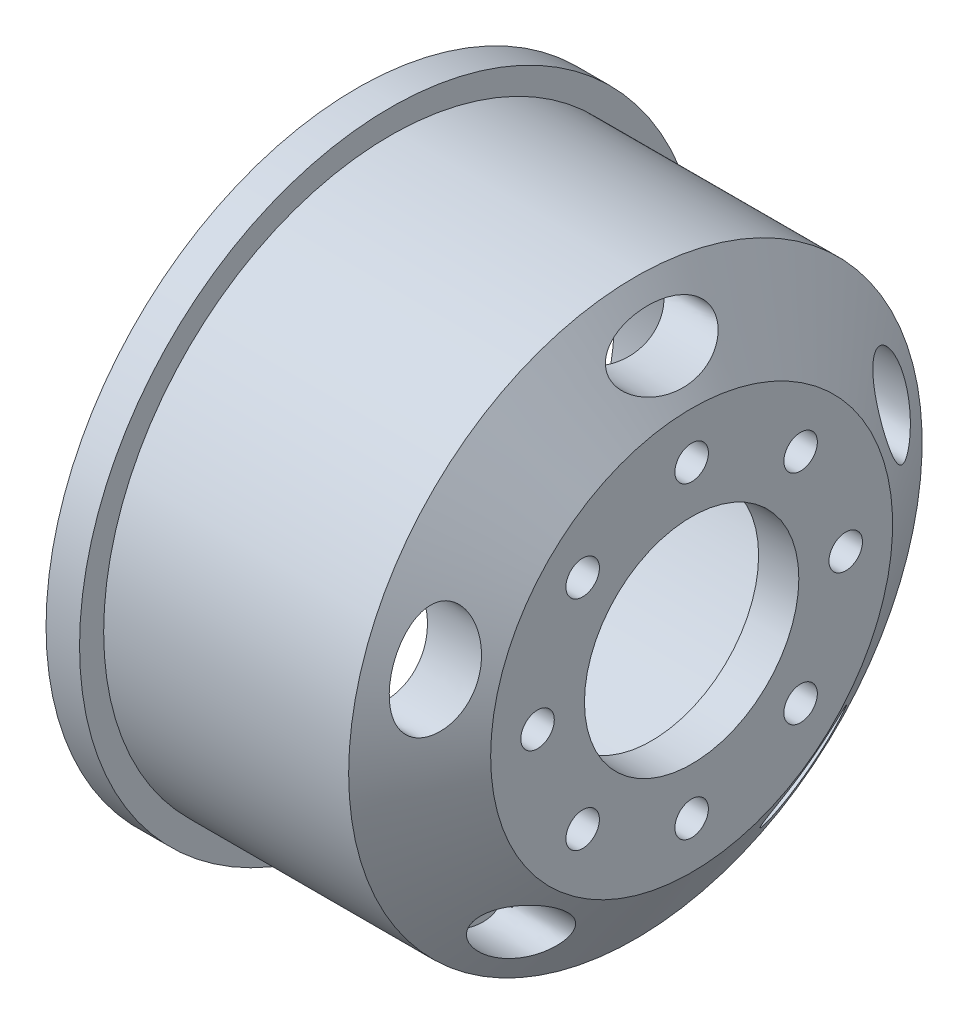
from build123d import *

# Parameters (mm, degrees)
CUT_EXTRUDE1_START     = -7
CUT_EXTRUDE1_OUTLINE_R = 1.25
CUT_EXTRUDE1_DEPTH     = 7


with BuildPart() as part:
    # Sketch3 → Revolve1 (revolve)
    with BuildSketch(Plane(origin=(0, 0, 0), x_dir=(1, 0, 0), z_dir=(0, 1, 0)), mode=Mode.PRIVATE) as revolve1_sk:
        Polygon((8.717608539, 21.4), (-7.11067022, 21.4), (-7.11067022, 23.2), (-8.61067022, 23.2), (-9.61067022, 23.2), (-9.61067022, 22.2), (-8.61067022, 22.2), (-8.61067022, 18.231946605), (9.211549898, 18.231946605), (12.36932978, 13.417613419), (12.36932978, 8), (15.36932978, 8), (15.36932978, 15), (11.171491687, 21.4), align=None)
    revolve(revolve1_sk.sketch.rotate(Axis((-29.774212385, 0, 0), (1, 0, 0)), 180), axis=Axis((-29.774212385, 0, 0), (1, 0, 0)))

    # Cut-Extrude1: read off the stored shape, not the designer's step
    # Cut-Extrude1 outline → Cut-Extrude1 (cut)
    with BuildSketch(Plane(origin=(15.36932978, 0, 0), x_dir=(0, 0, -1), z_dir=(1, 0, 0)).offset(CUT_EXTRUDE1_START)):
        with BuildLine():
            add(Edge.make_bspline(
                [(-15.882949316, 9.366531964), (-19.17750573, 10.436998233), (-19.384329489, 4.195426001), (-19.591153248, -2.046146232), (-16.089773075, 3.124959731), (-12.588392902, 8.296065695), (-15.882949316, 9.366531964)],
                knots=[0, 0, 0, 2.094395102, 2.094395102, 4.188790205, 4.188790205, 6.283185307, 6.283185307, 6.283185307], degree=2, weights=[1, 0.5, 1, 0.5, 1, 0.5, 1]))
        make_face()
        with BuildLine():
            add(Edge.make_bspline(
                [(-13.816202519, -12.21116489), (-15.852350361, -15.013681966), (-9.980174473, -17.139134942), (-4.107998586, -19.264587917), (-7.944026632, -14.336617865), (-11.780054677, -9.408647813), (-13.816202519, -12.21116489)],
                knots=[0, 0, 0, 2.094395102, 2.094395102, 4.188790205, 4.188790205, 6.283185307, 6.283185307, 6.283185307], degree=2, weights=[1, 0.5, 1, 0.5, 1, 0.5, 1]))
        make_face()
        with BuildLine():
            add(Edge.make_bspline(
                [(7.344066564, -16.913446908), (9.380214406, -19.715963985), (13.216242451, -14.787993933), (17.052270496, -9.86002388), (11.180094609, -11.985476856), (5.307918722, -14.110929831), (7.344066564, -16.913446908)],
                knots=[0, 0, 0, 2.094395102, 2.094395102, 4.188790205, 4.188790205, 6.283185307, 6.283185307, 6.283185307], degree=2, weights=[1, 0.5, 1, 0.5, 1, 0.5, 1]))
        make_face()
        with BuildLine():
            add(Edge.make_bspline(
                [(18.355085271, 1.758079834), (21.649641685, 2.828546103), (18.148261512, 7.999652066), (14.646881338, 13.170758029), (14.853705097, 6.929185797), (15.060528857, 0.687613564), (18.355085271, 1.758079834)],
                knots=[0, 0, 0, 2.094395102, 2.094395102, 4.188790205, 4.188790205, 6.283185307, 6.283185307, 6.283185307], degree=2, weights=[1, 0.5, 1, 0.5, 1, 0.5, 1]))
        make_face()
        with BuildLine():
            add(Edge.make_bspline(
                [(4, 18), (4, 21.464101615), (-2, 19.732050808), (-8, 18), (-2, 16.267949192), (4, 14.535898385), (4, 18)],
                knots=[0, 0, 0, 2.094395102, 2.094395102, 4.188790205, 4.188790205, 6.283185307, 6.283185307, 6.283185307], degree=2, weights=[1, 0.5, 1, 0.5, 1, 0.5, 1]))
        make_face()
        with Locations((0, 11.5)):
            Circle(CUT_EXTRUDE1_OUTLINE_R)
        with Locations((8.131727984, 8.131727984)):
            Circle(CUT_EXTRUDE1_OUTLINE_R)
        with Locations((11.5, 0)):
            Circle(CUT_EXTRUDE1_OUTLINE_R)
        with Locations((8.131727984, -8.131727984)):
            Circle(CUT_EXTRUDE1_OUTLINE_R)
        with Locations((0, -11.5)):
            Circle(CUT_EXTRUDE1_OUTLINE_R)
        with Locations((-8.131727984, -8.131727984)):
            Circle(CUT_EXTRUDE1_OUTLINE_R)
        with Locations((-11.5, 0)):
            Circle(CUT_EXTRUDE1_OUTLINE_R)
        with Locations((-8.131727984, 8.131727984)):
            Circle(CUT_EXTRUDE1_OUTLINE_R)
    extrude(amount=CUT_EXTRUDE1_DEPTH, mode=Mode.SUBTRACT)


solid = part.part
